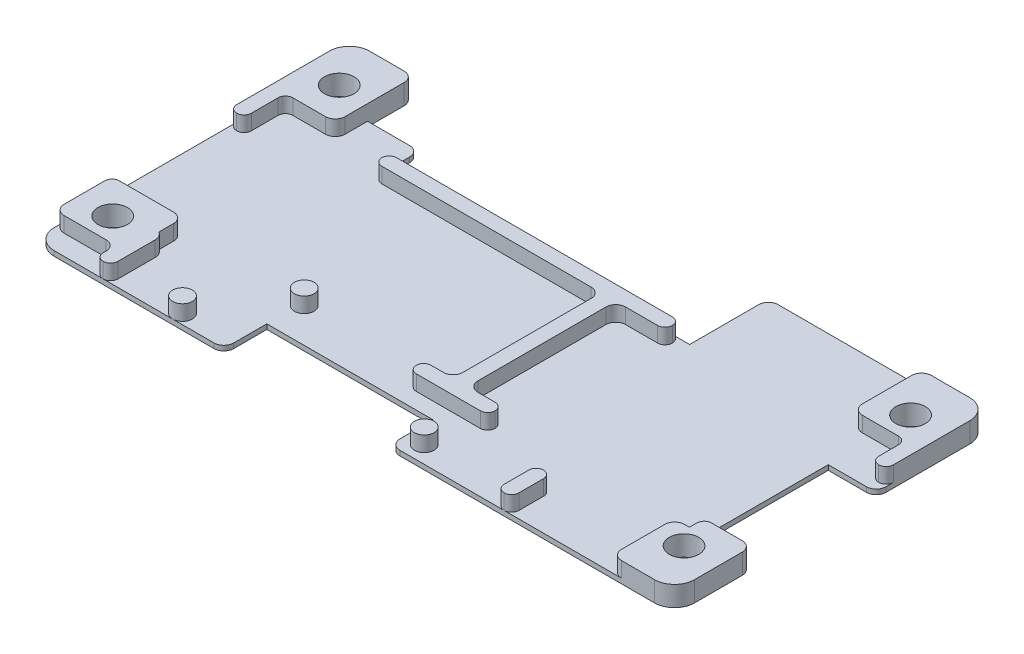
from build123d import *

# Parameters (mm, degrees)
SKETCH1_R           = 1.5
BOSS_EXTRUDE1_DEPTH = 0.5
SKETCH2_W           = 16.871696
SKETCH2_H           = 4.360926
SKETCH2_W_2         = 4.86899
SKETCH2_H_2         = 12.600052
CUT_EXTRUDE2_DEPTH  = 37.229212531
FILLET1_R           = 1
SKETCH3_R           = 1
SKETCH3_W           = 1.5
SKETCH3_H           = 4
SKETCH3_R_2         = 1.5
BOSS_EXTRUDE2_DEPTH = 2.05
FILLET2_R           = 1
FILLET4_R           = 0.75


# Some blends are built 0.0001 mm under size
with BuildPart() as part:
    # Sketch1 → Boss-Extrude1 (new body)
    with BuildSketch(Plane.XZ.offset(3.35)):
        with BuildLine():
            Line((-30.468062, -16.001619), (30.468062, -16.001619))
            ThreePointArc((30.468062, -16.001619), (31.904902979, -15.406459979), (32.500062, -13.969619))
            Line((32.500062, -13.969619), (32.500062, 13.969619))
            ThreePointArc((32.500062, 13.969619), (31.904902979, 15.406459979), (30.468062, 16.001619))
            Line((30.468062, 16.001619), (-30.468062, 16.001619))
            ThreePointArc((-30.468062, 16.001619), (-31.904902979, 15.406459979), (-32.500062, 13.969619))
            Line((-32.500062, 13.969619), (-32.500062, -13.969619))
            ThreePointArc((-32.500062, -13.969619), (-31.904902979, -15.406459979), (-30.468062, -16.001619))
        make_face()
        with Locations(Location((28.999942, -11.463655, 0), (0, 0, 270))):
            Circle(SKETCH1_R, mode=Mode.SUBTRACT)
        with Locations(Location((28.999942, 11.536299, 0), (0, 0, 270))):
            Circle(SKETCH1_R, mode=Mode.SUBTRACT)
        with Locations(Location((-29.000196, -11.463655, 0), (0, 0, 270))):
            Circle(SKETCH1_R, mode=Mode.SUBTRACT)
        with Locations(Location((-29.000196, 11.536299, 0), (0, 0, 270))):
            Circle(SKETCH1_R, mode=Mode.SUBTRACT)
    extrude(amount=-BOSS_EXTRUDE1_DEPTH)

    # Sketch2 → Cut-Extrude2 (cut, through all)
    with BuildSketch(Plane.XZ.offset(3.35)):
        with Locations((-4.81203, 13.821156)):
            Rectangle(SKETCH2_W, SKETCH2_H)
        Polygon((-20.66863, -8.001619), (10.02857, -8.001619), (10.02857, -16.001619), (-25.94464, -16.001619), (-25.94464, -11.279987), (-20.66863, -11.279987), align=None)
        with Locations((30.065567, 1.825117)):
            Rectangle(SKETCH2_W_2, SKETCH2_H_2)
    extrude(amount=-CUT_EXTRUDE2_DEPTH, mode=Mode.SUBTRACT)

    # Fillet1
    fillet1_edges = [part.edges().sort_by_distance(p)[0] for p in [
        (-13.247878, -3.1, 16.001619),
        (3.623818, -3.1, 16.001619),
        (-20.66863, -3.1, -11.279987),
        (10.02857, -3.1, -16.001619),
        (-25.94464, -3.1, -16.001619),
        (32.500062, -3.1, 8.125143),
        (32.500062, -3.1, -4.474909),
    ]]
    fillet(fillet1_edges, radius=FILLET1_R)

    # Sketch3 → Boss-Extrude2 (add)
    # profile 1 of 9: a face of its own
    with BuildSketch(Plane.XZ.offset(3.35)):
        with Locations(Location((-12.947878, 8.140693, 0), (0, 0, 270))):
            Circle(SKETCH3_R)
    # profile 2 of 9: a face of its own
    with BuildSketch(Plane.XZ.offset(3.35)):
        with Locations(Location((-18.447878, 15.001619, 0), (0, 0, 90))):
            Circle(SKETCH3_R)
    # profile 3 of 9: a face of its own
    with BuildSketch(Plane.XZ.offset(3.35)):
        with Locations(Location((5.356479, 14.268958, 0), (0, 0, 270))):
            Circle(SKETCH3_R)
    # profile 4 of 9: a face of its own
    with BuildSketch(Plane.XZ.offset(3.35)):
        Polygon((-20.46863, -8.001619), (9.02857, -8.001619), (9.02857, -6.501619), (4.02857, -6.501619), (4.02857, 8.498381), (7.52857, 8.498381), (7.52857, 9.998381), (-0.47143, 9.998381), (-0.47143, 8.498381), (2.52857, 8.498381), (2.52857, -6.501619), (-20.46863, -6.501619), align=None)
    # profile 5 of 9: a face of its own
    with BuildSketch(Plane.XZ.offset(3.35)):
        with Locations((15.204059, 14.001619)):
            Rectangle(SKETCH3_W, SKETCH3_H)
    # profile 6 of 9: a face of its own
    with BuildSketch(Plane.XZ.offset(3.35)):
        with BuildLine():
            Line((-32.500062, -3.797223), (-32.500062, -13.969619))
            ThreePointArc((-32.500062, -13.969619), (-31.904902979, -15.406459979), (-30.468062, -16.001619))
            Line((-30.468062, -16.001619), (-26.94464, -16.001619))
            ThreePointArc((-26.94464, -16.001619), (-26.237533219, -15.708725781), (-25.94464, -15.001619))
            Line((-25.94464, -15.001619), (-25.94464, -8.001619))
            Line((-25.94464, -8.001619), (-31.000062, -8.001619))
            Line((-31.000062, -8.001619), (-31.000062, -3.797223))
            Line((-31.000062, -3.797223), (-32.500062, -3.797223))
        make_face()
        with Locations(Location((-29.000196, -11.463655, 0), (0, 0, 270))):
            Circle(SKETCH3_R_2, mode=Mode.SUBTRACT)
    # profile 7 of 9: a face of its own
    with BuildSketch(Plane.XZ.offset(3.35)):
        with BuildLine():
            Line((32.500062, -5.474909), (31.000062, -5.474909))
            Line((31.000062, -5.474909), (31.000062, -9.001619))
            Line((31.000062, -9.001619), (25.569228, -9.001619))
            Line((25.569228, -9.001619), (25.569228, -16.001619))
            Line((25.569228, -16.001619), (30.468062, -16.001619))
            ThreePointArc((30.468062, -16.001619), (31.904902979, -15.406459979), (32.500062, -13.969619))
            Line((32.500062, -13.969619), (32.500062, -5.474909))
        make_face()
        with Locations(Location((28.999942, -11.463655, 0), (0, 0, 270))):
            Circle(SKETCH3_R_2, mode=Mode.SUBTRACT)
    # profile 8 of 9: a face of its own
    with BuildSketch(Plane.XZ.offset(3.35)):
        with BuildLine():
            Line((27.631072, 8.125143), (27.631072, 9.625143))
            Line((27.631072, 9.625143), (26.131072, 9.625143))
            Line((26.131072, 9.625143), (26.131072, 16.001619))
            Line((26.131072, 16.001619), (30.468062, 16.001619))
            ThreePointArc((30.468062, 16.001619), (31.904902979, 15.406459979), (32.500062, 13.969619))
            Line((32.500062, 13.969619), (32.500062, 9.125143))
            ThreePointArc((32.500062, 9.125143), (32.207168781, 8.418036219), (31.500062, 8.125143))
            Line((31.500062, 8.125143), (27.631072, 8.125143))
        make_face()
        with Locations(Location((28.999942, 11.536299, 0), (0, 0, 270))):
            Circle(SKETCH3_R_2, mode=Mode.SUBTRACT)
    # profile 9 of 9: a face of its own
    with BuildSketch(Plane.XZ.offset(3.35)):
        with BuildLine():
            Line((-32.500062, 8.102777), (-25.250062, 8.102777))
            Line((-25.250062, 8.102777), (-25.250062, 10.602777))
            Line((-25.250062, 10.602777), (-24.750062, 10.602777))
            Line((-24.750062, 10.602777), (-24.750062, 16.001619))
            Line((-24.750062, 16.001619), (-26.250062, 16.001619))
            Line((-26.250062, 16.001619), (-26.250062, 13.958671))
            Line((-26.250062, 13.958671), (-31.500062, 13.958671))
            ThreePointArc((-31.500062, 13.958671), (-32.207168781, 13.665777781), (-32.500062, 12.958671))
            Line((-32.500062, 12.958671), (-32.500062, 8.102777))
        make_face()
        with Locations(Location((-29.000196, 11.536299, 0), (0, 0, 270))):
            Circle(SKETCH3_R_2, mode=Mode.SUBTRACT)
    extrude(amount=-BOSS_EXTRUDE2_DEPTH)

    # Fillet2
    # the kernel refuses this fillet: 1 mm, written as the material it adds along each edge
    with BuildSketch(Plane(origin=(4.02857, -5.35, -6.501619), x_dir=(1, 0, 0), z_dir=(0, 1, 0))) as fillet2_piece_1_section:
        with BuildLine():
            CenterArc((FILLET2_R, -FILLET2_R), FILLET2_R, 90, 90)
            Line((0, -FILLET2_R), (0, 0))
            Line((0, 0), (FILLET2_R, 0))
        make_face()
    fillet2_piece_1 = extrude(amount=4.05, mode=Mode.PRIVATE)
    fillet2_piece_1 = split(fillet2_piece_1, bisect_by=Plane(origin=(4.02857, -3.35, -6.501619), z_dir=(0, 1, 0)), keep=Keep.TOP, mode=Mode.PRIVATE)
    add(fillet2_piece_1)
    with BuildSketch(Plane(origin=(2.52857, -5.35, -6.501619), x_dir=(0, 0, 1), z_dir=(0, 1, 0))) as fillet2_piece_2_section:
        with BuildLine():
            CenterArc((FILLET2_R, -FILLET2_R), FILLET2_R, 90, 90)
            Line((0, -FILLET2_R), (0, 0))
            Line((0, 0), (FILLET2_R, 0))
        make_face()
    fillet2_piece_2 = extrude(amount=4.05, mode=Mode.PRIVATE)
    fillet2_piece_2 = split(fillet2_piece_2, bisect_by=Plane(origin=(2.52857, -3.35, -6.501619), z_dir=(0, 1, 0)), keep=Keep.TOP, mode=Mode.PRIVATE)
    add(fillet2_piece_2)
    with BuildSketch(Plane(origin=(2.52857, -5.35, 8.498381), x_dir=(-1, 0, 0), z_dir=(0, 1, 0))) as fillet2_piece_3_section:
        with BuildLine():
            CenterArc((FILLET2_R, -FILLET2_R), FILLET2_R, 90, 90)
            Line((0, -FILLET2_R), (0, 0))
            Line((0, 0), (FILLET2_R, 0))
        make_face()
    fillet2_piece_3 = extrude(amount=4.05, mode=Mode.PRIVATE)
    fillet2_piece_3 = split(fillet2_piece_3, bisect_by=Plane(origin=(2.52857, -3.35, 8.498381), z_dir=(0, 1, 0)), keep=Keep.TOP, mode=Mode.PRIVATE)
    add(fillet2_piece_3)
    with BuildSketch(Plane(origin=(4.02857, -5.35, 8.498381), x_dir=(0, 0, -1), z_dir=(0, 1, 0))) as fillet2_piece_4_section:
        with BuildLine():
            CenterArc((FILLET2_R, -FILLET2_R), FILLET2_R, 90, 90)
            Line((0, -FILLET2_R), (0, 0))
            Line((0, 0), (FILLET2_R, 0))
        make_face()
    fillet2_piece_4 = extrude(amount=4.05, mode=Mode.PRIVATE)
    fillet2_piece_4 = split(fillet2_piece_4, bisect_by=Plane(origin=(4.02857, -3.35, 8.498381), z_dir=(0, 1, 0)), keep=Keep.TOP, mode=Mode.PRIVATE)
    add(fillet2_piece_4)
    with BuildSketch(Plane(origin=(-26.250062, -5.35, 13.958671), x_dir=(-1, 0, 0), z_dir=(0, 1, 0))) as fillet2_piece_5_section:
        with BuildLine():
            CenterArc((FILLET2_R, FILLET2_R), FILLET2_R, 180, 90)
            Line((0, FILLET2_R), (0, 0))
            Line((0, 0), (FILLET2_R, 0))
        make_face()
    fillet2_piece_5 = extrude(amount=4.05, mode=Mode.PRIVATE)
    fillet2_piece_5 = split(fillet2_piece_5, bisect_by=Plane(origin=(-26.250062, -3.35, 13.958671), z_dir=(0, 1, 0)), keep=Keep.TOP, mode=Mode.PRIVATE)
    add(fillet2_piece_5)
    # the kernel refuses this fillet: 1 mm, written as the material it takes off along each edge
    with BuildSketch(Plane(origin=(-25.94464, -2.85, -8.001619), x_dir=(0, 0, -1), z_dir=(0, 1, 0)), Plane(origin=(26.131072, -2.85, 16.001619), x_dir=(1, 0, 0), z_dir=(0, 1, 0)), Plane(origin=(26.131072, -2.85, 9.625143), x_dir=(0, 0, 1), z_dir=(0, 1, 0)), Plane(origin=(-25.250062, -2.85, 8.102777), x_dir=(-1, 0, 0), z_dir=(0, 1, 0))) as fillet2_2_piece_1:
        with BuildLine():
            CenterArc((FILLET2_R, FILLET2_R), FILLET2_R, 180, 90)
            Line((0, FILLET2_R), (0, 0))
            Line((0, 0), (FILLET2_R, 0))
        make_face()
    extrude(amount=4.05, mode=Mode.SUBTRACT)
    with BuildSketch(Plane(origin=(25.569228, -2.85, -16.001619), x_dir=(1, 0, 0), z_dir=(0, 1, 0)), Plane(origin=(25.569228, -2.85, -9.001619), x_dir=(0, 0, -1), z_dir=(0, 1, 0))) as fillet2_2_piece_2:
        with BuildLine():
            CenterArc((FILLET2_R, -FILLET2_R), FILLET2_R, 90, 90)
            Line((0, -FILLET2_R), (0, 0))
            Line((0, 0), (FILLET2_R, 0))
        make_face()
    extrude(amount=4.05, mode=Mode.SUBTRACT)
    with BuildSketch(Plane(origin=(-24.750062, -2.85, 10.602777), x_dir=(0, 0, 1), z_dir=(0, 1, 0))) as fillet2_2_piece_3:
        with BuildLine():
            CenterArc((0.866025404, -1), FILLET2_R, 90, 60)
            Line((0, -0.5), (0, 0))
            Line((0, 0), (0.866025404, 0))
        make_face()
    extrude(amount=3.715063509, mode=Mode.SUBTRACT)

    # Fillet4
    fillet4_edges = [part.edges().sort_by_distance(p)[0] for p in [
        (-31.000062, -2.075, -8.001619),
        (-20.46863, -2.075, -8.001619),
        (-20.46863, -2.075, -6.501619),
        (-0.47143, -2.075, 8.498381),
        (-0.47143, -2.075, 9.998381),
        (7.52857, -2.075, 9.998381),
        (7.52857, -2.075, 8.498381),
        (9.02857, -2.075, -8.001619),
        (9.02857, -2.075, -6.501619),
        (31.000062, -2.075, -9.001619),
        (31.000062, -2.075, -5.474909),
        (32.500062, -2.075, -5.474909),
        (27.631072, -2.075, 8.125143),
        (14.454059, -2.075, 12.001619),
        (15.954059, -2.075, 12.001619),
        (15.954059, -2.075, 16.001619),
        (14.454059, -2.075, 16.001619),
        (-32.500062, -2.075, 8.102777),
        (-24.750062, -2.075, 16.001619),
        (-26.250062, -2.075, 16.001619),
        (-31.000062, -2.075, -3.797223),
        (-32.500062, -2.075, -3.797223),
    ]]
    fillet(fillet4_edges, radius=FILLET4_R - 0.0001)  # a hair under: the kernel refuses the full size


solid = part.part
